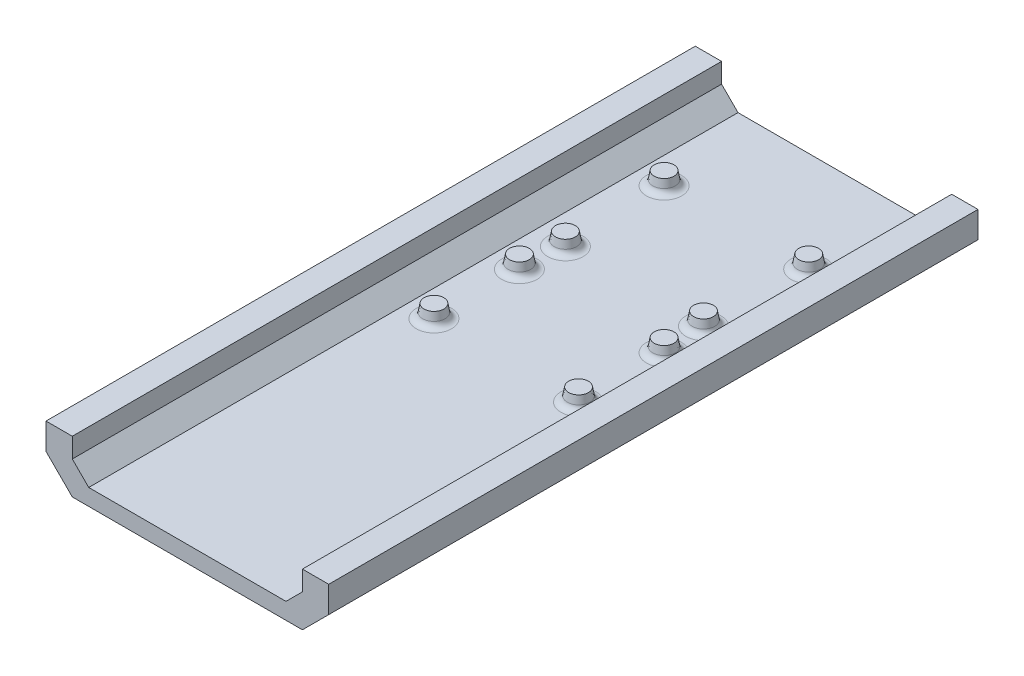
from build123d import *

# Parameters (mm, degrees)
BASE_START                    = -6.554843364
BASE_OUTLINE_R                = 2.2098
BASE_DEPTH                    = 1.5875
SKETCH1_R                     = 3.81
BOSS_EXTRUDE1_DEPTH           = 5.08
BOSS_EXTRUDE1_DRAFT           = -10
BOSS_EXTRUDE1_PROFILE_2_DEPTH = 5.08
BOSS_EXTRUDE1_PROFILE_2_DRAFT = -10
BOSS_EXTRUDE1_PROFILE_3_DEPTH = 5.08
BOSS_EXTRUDE1_PROFILE_3_DRAFT = -10
BOSS_EXTRUDE1_PROFILE_4_DEPTH = 5.08
BOSS_EXTRUDE1_PROFILE_4_DRAFT = -10
BOSS_EXTRUDE1_PROFILE_5_DEPTH = 5.08
BOSS_EXTRUDE1_PROFILE_5_DRAFT = -10
BOSS_EXTRUDE1_PROFILE_6_DEPTH = 5.08
BOSS_EXTRUDE1_PROFILE_6_DRAFT = -10
BOSS_EXTRUDE1_PROFILE_7_DEPTH = 5.08
BOSS_EXTRUDE1_PROFILE_7_DRAFT = -10
BOSS_EXTRUDE1_PROFILE_8_DEPTH = 5.08
BOSS_EXTRUDE1_PROFILE_8_DRAFT = -10
BOSS_EXTRUDE2_DEPTH           = 34.925
BOSS_EXTRUDE2_DEPTH_BACK      = 215.9
CUT_EXTRUDE1_START            = -1.5875
CUT_EXTRUDE1_DEPTH            = 1.5875
FILLET1_R                     = 2.54


# Read off the part's stored shape, not the designer's step: base
with BuildPart() as part:
    # base outline → base (new body)
    with BuildSketch(Plane(origin=(0, 0, 0), x_dir=(1, 0, 0), z_dir=(0, 1, 0)).offset(BASE_START)):
        with BuildLine():
            Line((-49.899656567, 12.447933824), (-49.899656567, -30.732066176))
            ThreePointArc((-49.899656567, -30.732066176), (-49.155707791, -32.5281174), (-47.359656567, -33.272066176))
            Line((-47.359656567, -33.272066176), (11.060343433, -33.272066176))
            ThreePointArc((11.060343433, -33.272066176), (12.856394657, -32.5281174), (13.600343433, -30.732066176))
            Line((13.600343433, -30.732066176), (13.600343433, 12.447933824))
            ThreePointArc((13.600343433, 12.447933824), (12.856394657, 14.243985048), (11.060343433, 14.987933824))
            Line((11.060343433, 14.987933824), (8.520343433, 14.987933824))
            ThreePointArc((8.520343433, 14.987933824), (3.440343433, 20.067933824), (8.520343433, 25.147933824))
            Line((8.520343433, 25.147933824), (11.060343433, 25.147933824))
            ThreePointArc((11.060343433, 25.147933824), (12.856394657, 25.8918826), (13.600343433, 27.687933824))
            Line((13.600343433, 27.687933824), (13.600343433, 60.707933824))
            ThreePointArc((13.600343433, 60.707933824), (12.856394657, 62.503985048), (11.060343433, 63.247933824))
            Line((11.060343433, 63.247933824), (-47.359656567, 63.247933824))
            ThreePointArc((-47.359656567, 63.247933824), (-49.155707791, 62.503985048), (-49.899656567, 60.707933824))
            Line((-49.899656567, 60.707933824), (-49.899656567, 27.687933824))
            ThreePointArc((-49.899656567, 27.687933824), (-49.155707791, 25.8918826), (-47.359656567, 25.147933824))
            Line((-47.359656567, 25.147933824), (-44.819656567, 25.147933824))
            ThreePointArc((-44.819656567, 25.147933824), (-39.739656567, 20.067933824), (-44.819656567, 14.987933824))
            Line((-44.819656567, 14.987933824), (-47.359656567, 14.987933824))
            ThreePointArc((-47.359656567, 14.987933824), (-49.155707791, 14.243985048), (-49.899656567, 12.447933824))
        make_face()
        with Locations((-46.089656567, -29.462066176)):
            Circle(BASE_OUTLINE_R, mode=Mode.SUBTRACT)
        with Locations((-46.089656567, 3.557933824)):
            Circle(BASE_OUTLINE_R, mode=Mode.SUBTRACT)
        with Locations((9.790343433, -29.462066176)):
            Circle(BASE_OUTLINE_R, mode=Mode.SUBTRACT)
        with Locations((9.790343433, 3.557933824)):
            Circle(BASE_OUTLINE_R, mode=Mode.SUBTRACT)
        with Locations((-46.089656567, 59.437933824)):
            Circle(BASE_OUTLINE_R, mode=Mode.SUBTRACT)
        with Locations((9.790343433, 59.437933824)):
            Circle(BASE_OUTLINE_R, mode=Mode.SUBTRACT)
    extrude(amount=BASE_DEPTH)


with BuildPart() as boss_extrude1_tool:
    # Sketch1 → Boss-Extrude1 (with draft: the straight prism first)
    with BuildSketch(Plane.XZ.offset(6.554843364)):
        with Locations((-46.089656567, -59.437933824)):
            Circle(SKETCH1_R)
    extrude(amount=BOSS_EXTRUDE1_DEPTH)
    # Boss-Extrude1: the draft: its side faces are tilted about the plane it starts from
    boss_extrude1_sides = [boss_extrude1_tool.faces().sort_by_distance(p)[0] for p in [
        (-49.899656567, -9.094843364, -59.437933824),
    ]]
    draft(boss_extrude1_sides, Plane.XZ.offset(6.554843364), BOSS_EXTRUDE1_DRAFT)


with BuildPart() as part_1:
    add(part.part)

    # Boss-Extrude1: add boss_extrude1_tool
    add(boss_extrude1_tool.part)


with BuildPart() as boss_extrude1_profile_2_tool:
    # Sketch1 → Boss-Extrude1 profile 2 (with draft: the straight prism first)
    with BuildSketch(Plane.XZ.offset(6.554843364)):
        with Locations((-46.089656567, -3.557933824)):
            Circle(SKETCH1_R)
    extrude(amount=BOSS_EXTRUDE1_PROFILE_2_DEPTH)
    # Boss-Extrude1 profile 2: the draft: its side faces are tilted about the plane it starts from
    boss_extrude1_profile_2_sides = [boss_extrude1_profile_2_tool.faces().sort_by_distance(p)[0] for p in [
        (-49.899656567, -9.094843364, -3.557933824),
    ]]
    draft(boss_extrude1_profile_2_sides, Plane.XZ.offset(6.554843364), BOSS_EXTRUDE1_PROFILE_2_DRAFT)


with BuildPart() as part_2:
    add(part_1.part)

    # Boss-Extrude1 profile 2: add boss_extrude1_profile_2_tool
    add(boss_extrude1_profile_2_tool.part)


with BuildPart() as boss_extrude1_profile_3_tool:
    # Sketch1 → Boss-Extrude1 profile 3 (with draft: the straight prism first)
    with BuildSketch(Plane.XZ.offset(6.554843364)):
        with Locations((-46.089656567, 29.462066176)):
            Circle(SKETCH1_R)
    extrude(amount=BOSS_EXTRUDE1_PROFILE_3_DEPTH)
    # Boss-Extrude1 profile 3: the draft: its side faces are tilted about the plane it starts from
    boss_extrude1_profile_3_sides = [boss_extrude1_profile_3_tool.faces().sort_by_distance(p)[0] for p in [
        (-49.899656567, -9.094843364, 29.462066176),
    ]]
    draft(boss_extrude1_profile_3_sides, Plane.XZ.offset(6.554843364), BOSS_EXTRUDE1_PROFILE_3_DRAFT)


with BuildPart() as part_3:
    add(part_2.part)

    # Boss-Extrude1 profile 3: add boss_extrude1_profile_3_tool
    add(boss_extrude1_profile_3_tool.part)


with BuildPart() as boss_extrude1_profile_4_tool:
    # Sketch1 → Boss-Extrude1 profile 4 (with draft: the straight prism first)
    with BuildSketch(Plane.XZ.offset(6.554843364)):
        with Locations((9.790343433, 29.462066176)):
            Circle(SKETCH1_R)
    extrude(amount=BOSS_EXTRUDE1_PROFILE_4_DEPTH)
    # Boss-Extrude1 profile 4: the draft: its side faces are tilted about the plane it starts from
    boss_extrude1_profile_4_sides = [boss_extrude1_profile_4_tool.faces().sort_by_distance(p)[0] for p in [
        (5.980343433, -9.094843364, 29.462066176),
    ]]
    draft(boss_extrude1_profile_4_sides, Plane.XZ.offset(6.554843364), BOSS_EXTRUDE1_PROFILE_4_DRAFT)


with BuildPart() as part_4:
    add(part_3.part)

    # Boss-Extrude1 profile 4: add boss_extrude1_profile_4_tool
    add(boss_extrude1_profile_4_tool.part)


with BuildPart() as boss_extrude1_profile_5_tool:
    # Sketch1 → Boss-Extrude1 profile 5 (with draft: the straight prism first)
    with BuildSketch(Plane.XZ.offset(6.554843364)):
        with Locations((9.790343433, -3.557933824)):
            Circle(SKETCH1_R)
    extrude(amount=BOSS_EXTRUDE1_PROFILE_5_DEPTH)
    # Boss-Extrude1 profile 5: the draft: its side faces are tilted about the plane it starts from
    boss_extrude1_profile_5_sides = [boss_extrude1_profile_5_tool.faces().sort_by_distance(p)[0] for p in [
        (5.980343433, -9.094843364, -3.557933824),
    ]]
    draft(boss_extrude1_profile_5_sides, Plane.XZ.offset(6.554843364), BOSS_EXTRUDE1_PROFILE_5_DRAFT)


with BuildPart() as part_5:
    add(part_4.part)

    # Boss-Extrude1 profile 5: add boss_extrude1_profile_5_tool
    add(boss_extrude1_profile_5_tool.part)


with BuildPart() as boss_extrude1_profile_6_tool:
    # Sketch1 → Boss-Extrude1 profile 6 (with draft: the straight prism first)
    with BuildSketch(Plane.XZ.offset(6.554843364)):
        with Locations((9.790343433, -59.437933824)):
            Circle(SKETCH1_R)
    extrude(amount=BOSS_EXTRUDE1_PROFILE_6_DEPTH)
    # Boss-Extrude1 profile 6: the draft: its side faces are tilted about the plane it starts from
    boss_extrude1_profile_6_sides = [boss_extrude1_profile_6_tool.faces().sort_by_distance(p)[0] for p in [
        (5.980343433, -9.094843364, -59.437933824),
    ]]
    draft(boss_extrude1_profile_6_sides, Plane.XZ.offset(6.554843364), BOSS_EXTRUDE1_PROFILE_6_DRAFT)


with BuildPart() as part_6:
    add(part_5.part)

    # Boss-Extrude1 profile 6: add boss_extrude1_profile_6_tool
    add(boss_extrude1_profile_6_tool.part)



with BuildPart() as body_2:
    # Sketch1 → Boss-Extrude1 profile 7 (with draft: the straight prism first)
    with BuildSketch(Plane.XZ.offset(6.554843364)):
        with Locations((8.520343433, -20.067933824)):
            Circle(SKETCH1_R)
    extrude(amount=BOSS_EXTRUDE1_PROFILE_7_DEPTH)
    # Boss-Extrude1 profile 7: the draft: its side faces are tilted about the plane it starts from
    boss_extrude1_profile_7_sides = [body_2.faces().sort_by_distance(p)[0] for p in [
        (4.710343433, -9.094843364, -20.067933824),
    ]]
    draft(boss_extrude1_profile_7_sides, Plane.XZ.offset(6.554843364), BOSS_EXTRUDE1_PROFILE_7_DRAFT)


with BuildPart() as body_3:
    # Sketch1 → Boss-Extrude1 profile 8 (with draft: the straight prism first)
    with BuildSketch(Plane.XZ.offset(6.554843364)):
        with Locations((-44.819656567, -20.067933824)):
            Circle(SKETCH1_R)
    extrude(amount=BOSS_EXTRUDE1_PROFILE_8_DEPTH)
    # Boss-Extrude1 profile 8: the draft: its side faces are tilted about the plane it starts from
    boss_extrude1_profile_8_sides = [body_3.faces().sort_by_distance(p)[0] for p in [
        (-48.629656567, -9.094843364, -20.067933824),
    ]]
    draft(boss_extrude1_profile_8_sides, Plane.XZ.offset(6.554843364), BOSS_EXTRUDE1_PROFILE_8_DRAFT)


with BuildPart() as part_7:
    add(part_6.part)

    add(body_2.part)  # Boss-Extrude2 merges body 2

    add(body_3.part)  # Boss-Extrude2 merges body 3
    # Sketch2 → Boss-Extrude2 (add, two sides: drawn at the far end of the back side and taken through both)
    with BuildSketch(Plane(origin=(0, 0, -63.247933824), x_dir=(-1, 0, 0), z_dir=(0, 0, -1)).offset(-BOSS_EXTRUDE2_DEPTH_BACK)):
        Polygon((-19.950343433, -11.634843364), (56.249656567, -11.634843364), (62.599656567, -5.284843364), (62.599656567, 2.335156636), (72.759656567, 2.335156636), (72.759656567, -7.824843364), (62.599656567, -17.984843364), (-26.300343433, -17.984843364), (-36.460343433, -7.824843364), (-36.460343433, 2.335156636), (-26.300343433, 2.335156636), (-26.300343433, -5.284843364), align=None)
    extrude(amount=BOSS_EXTRUDE2_DEPTH + BOSS_EXTRUDE2_DEPTH_BACK)

    # Sketch3 → Cut-Extrude1 (cut)
    with BuildSketch(Plane(origin=(0, -4.967343364, 0), x_dir=(1, 0, 0), z_dir=(0, 1, 0)).offset(CUT_EXTRUDE1_START)):
        with BuildLine():
            Line((-47.359656567, -33.272066176), (11.060343433, -33.272066176))
            ThreePointArc((11.060343433, -33.272066176), (12.856394657, -32.5281174), (13.600343433, -30.732066176))
            Line((13.600343433, -30.732066176), (13.600343433, 12.447933824))
            ThreePointArc((13.600343433, 12.447933824), (12.856394657, 14.243985048), (11.060343433, 14.987933824))
            Line((11.060343433, 14.987933824), (8.520343433, 14.987933824))
            ThreePointArc((8.520343433, 14.987933824), (3.440343433, 20.067933824), (8.520343433, 25.147933824))
            Line((8.520343433, 25.147933824), (11.060343433, 25.147933824))
            ThreePointArc((11.060343433, 25.147933824), (12.856394657, 25.8918826), (13.600343433, 27.687933824))
            Line((13.600343433, 27.687933824), (13.600343433, 60.707933824))
            ThreePointArc((13.600343433, 60.707933824), (12.856394657, 62.503985048), (11.060343433, 63.247933824))
            Line((11.060343433, 63.247933824), (-47.359656567, 63.247933824))
            ThreePointArc((-47.359656567, 63.247933824), (-49.155707791, 62.503985048), (-49.899656567, 60.707933824))
            Line((-49.899656567, 60.707933824), (-49.899656567, 27.687933824))
            ThreePointArc((-49.899656567, 27.687933824), (-49.155707791, 25.8918826), (-47.359656567, 25.147933824))
            Line((-47.359656567, 25.147933824), (-44.819656567, 25.147933824))
            ThreePointArc((-44.819656567, 25.147933824), (-39.739656567, 20.067933824), (-44.819656567, 14.987933824))
            Line((-44.819656567, 14.987933824), (-47.359656567, 14.987933824))
            ThreePointArc((-47.359656567, 14.987933824), (-49.155707791, 14.243985048), (-49.899656567, 12.447933824))
            Line((-49.899656567, 12.447933824), (-49.899656567, -30.732066176))
            ThreePointArc((-49.899656567, -30.732066176), (-49.155707791, -32.5281174), (-47.359656567, -33.272066176))
        make_face()
    extrude(amount=CUT_EXTRUDE1_DEPTH, mode=Mode.SUBTRACT)

    # Fillet1
    fillet1_edges = [part_7.edges().sort_by_distance(p)[0] for p in [
        (-50.795397629, -11.634843364, -59.437933824),
        (-50.795397629, -11.634843364, -3.557933824),
        (-50.795397629, -11.634843364, 29.462066176),
        (5.084602371, -11.634843364, 29.462066176),
        (5.084602371, -11.634843364, -3.557933824),
        (5.084602371, -11.634843364, -59.437933824),
        (3.814602371, -11.634843364, -20.067933824),
        (-49.525397629, -11.634843364, -20.067933824),
    ]]
    fillet(fillet1_edges, radius=FILLET1_R)


solid = part_7.part
